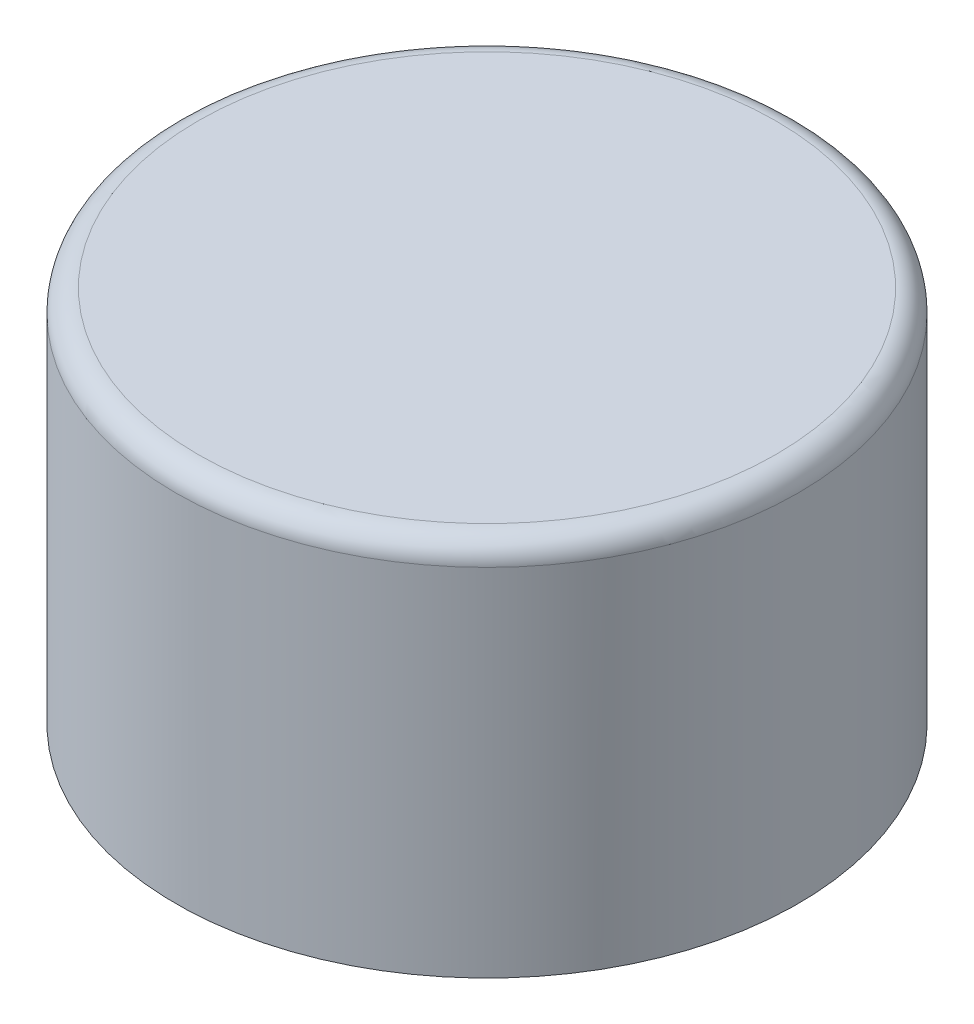
from build123d import *

# Parameters (mm, degrees)
SKETCH1_R           = 14
SKETCH1_R_2         = 13
BOSS_EXTRUDE1_DEPTH = 1
SKETCH2_R           = 4
BOSS_EXTRUDE2_DEPTH = 4
BOSS_EXTRUDE3_START = 16
SKETCH2_4_R         = 14
SKETCH2_4_R_2       = 13
BOSS_EXTRUDE3_DEPTH = 16
FILLET1_R           = 4
FILLET2_R           = 0.5
FILLET3_R           = 1


with BuildPart() as part:
    # Sketch1 → Boss-Extrude1 (new body)
    # profile 1 of 2: a face of its own
    with BuildSketch(Plane(origin=(0, 0, 0), x_dir=(1, 0, 0), z_dir=(0, 1, 0))):
        with Locations(Location((0, 0, 0), (0, 0, 270))):
            Circle(SKETCH1_R)
        Circle(SKETCH1_R_2, mode=Mode.SUBTRACT)
    # profile 2 of 2: a face of its own
    with BuildSketch(Plane(origin=(0, 0, 0), x_dir=(1, 0, 0), z_dir=(0, 1, 0))):
        Circle(SKETCH1_R_2)
    extrude(amount=BOSS_EXTRUDE1_DEPTH)

    # Sketch2 → Boss-Extrude2 (add)
    with BuildSketch(Plane.XZ):
        with Locations(Location((0, 0, 0), (0, 0, 270))):
            Circle(SKETCH2_R)
    extrude(amount=BOSS_EXTRUDE2_DEPTH)

    # Sketch2<4> → Boss-Extrude3 (add)
    with BuildSketch(Plane.XZ.offset(BOSS_EXTRUDE3_START)):
        with Locations(Location((0, 0, 0), (0, 0, 270))):
            Circle(SKETCH2_4_R)
        with Locations(Location((0, 0, 0), (0, 0, 270))):
            Circle(SKETCH2_4_R_2, mode=Mode.SUBTRACT)
    extrude(amount=-BOSS_EXTRUDE3_DEPTH)

    # Fillet1
    fillet1_edges = [part.edges().sort_by_distance(p)[0] for p in [
        (0, 0, 4),
    ]]
    fillet(fillet1_edges, radius=FILLET1_R - 0.0001)  # a hair under: the kernel refuses the full size

    # Fillet2
    fillet2_edges = [part.edges().sort_by_distance(p)[0] for p in [
        (0, -4, 4),
    ]]
    fillet(fillet2_edges, radius=FILLET2_R)

    # Fillet3
    fillet3_edges = [part.edges().sort_by_distance(p)[0] for p in [
        (0, 0, 13),
        (0, 1, -14),
    ]]
    fillet(fillet3_edges, radius=FILLET3_R - 0.0001)  # a hair under: the kernel refuses the full size


solid = part.part
